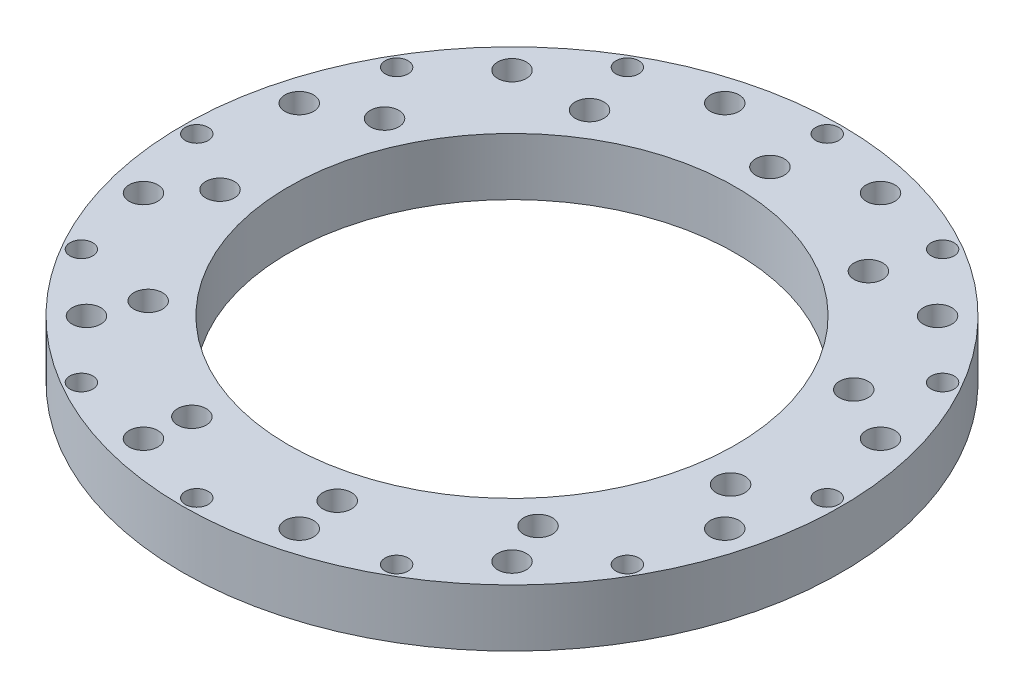
from build123d import *

# Parameters (mm, degrees)
SKETCH1_R           = 57.5
SKETCH1_R_2         = 39
SKETCH1_R_3         = 2
SKETCH1_R_4         = 2.5
BOSS_EXTRUDE1_DEPTH = 10
SKETCH2_R           = 2.5
CUT_EXTRUDE1_DEPTH  = 10


with BuildPart() as part:
    # Sketch1 → Boss-Extrude1 (new body)
    with BuildSketch(Plane(origin=(0, 0, 0), x_dir=(1, 0, 0), z_dir=(0, 1, 0))):
        Circle(SKETCH1_R)
        Circle(SKETCH1_R_2, mode=Mode.SUBTRACT)
        with Locations((0, 55)):
            Circle(SKETCH1_R_3, mode=Mode.SUBTRACT)
        with Locations((27.5, 47.631397208)):
            Circle(SKETCH1_R_3, mode=Mode.SUBTRACT)
        with Locations((47.631397208, 27.5)):
            Circle(SKETCH1_R_3, mode=Mode.SUBTRACT)
        with Locations((55, 0)):
            Circle(SKETCH1_R_3, mode=Mode.SUBTRACT)
        with Locations((47.631397208, -27.5)):
            Circle(SKETCH1_R_3, mode=Mode.SUBTRACT)
        with Locations((27.5, -47.631397208)):
            Circle(SKETCH1_R_3, mode=Mode.SUBTRACT)
        with Locations((0, -55)):
            Circle(SKETCH1_R_3, mode=Mode.SUBTRACT)
        with Locations((-27.5, -47.631397208)):
            Circle(SKETCH1_R_3, mode=Mode.SUBTRACT)
        with Locations((-47.631397208, -27.5)):
            Circle(SKETCH1_R_3, mode=Mode.SUBTRACT)
        with Locations((-55, 0)):
            Circle(SKETCH1_R_3, mode=Mode.SUBTRACT)
        with Locations((-47.631397208, 27.5)):
            Circle(SKETCH1_R_3, mode=Mode.SUBTRACT)
        with Locations((-27.5, 47.631397208)):
            Circle(SKETCH1_R_3, mode=Mode.SUBTRACT)
        with Locations((13.587999868, 50.71110588)):
            Circle(SKETCH1_R_4, mode=Mode.SUBTRACT)
        with Locations((37.123106012, 37.123106012)):
            Circle(SKETCH1_R_4, mode=Mode.SUBTRACT)
        with Locations((50.71110588, 13.587999868)):
            Circle(SKETCH1_R_4, mode=Mode.SUBTRACT)
        with Locations((50.71110588, -13.587999868)):
            Circle(SKETCH1_R_4, mode=Mode.SUBTRACT)
        with Locations((37.123106012, -37.123106012)):
            Circle(SKETCH1_R_4, mode=Mode.SUBTRACT)
        with Locations((13.587999868, -50.71110588)):
            Circle(SKETCH1_R_4, mode=Mode.SUBTRACT)
        with Locations((-13.587999868, -50.71110588)):
            Circle(SKETCH1_R_4, mode=Mode.SUBTRACT)
        with Locations((-37.123106012, -37.123106012)):
            Circle(SKETCH1_R_4, mode=Mode.SUBTRACT)
        with Locations((-50.71110588, -13.587999868)):
            Circle(SKETCH1_R_4, mode=Mode.SUBTRACT)
        with Locations((-50.71110588, 13.587999868)):
            Circle(SKETCH1_R_4, mode=Mode.SUBTRACT)
        with Locations((-37.123106012, 37.123106012)):
            Circle(SKETCH1_R_4, mode=Mode.SUBTRACT)
        with Locations((-13.587999868, 50.71110588)):
            Circle(SKETCH1_R_4, mode=Mode.SUBTRACT)
    extrude(amount=BOSS_EXTRUDE1_DEPTH)

    # Sketch2 → Cut-Extrude1 (cut)
    with BuildSketch(Plane(origin=(0, 10, 0), x_dir=(1, 0, 0), z_dir=(0, 1, 0))):
        with Locations((0, 45)):
            Circle(SKETCH2_R)
        with Locations((24.328836786, 37.856408977)):
            Circle(SKETCH2_R)
        with Locations((40.933439791, 18.693675585)):
            Circle(SKETCH2_R)
        with Locations((44.541964885, -6.404167722)):
            Circle(SKETCH2_R)
        with Locations((34.008730846, -29.468733028)):
            Circle(SKETCH2_R)
        with Locations((12.677965058, -43.177183813)):
            Circle(SKETCH2_R)
        with Locations((-12.677965058, -43.177183813)):
            Circle(SKETCH2_R)
        with Locations((-34.008730846, -29.468733028)):
            Circle(SKETCH2_R)
        with Locations((-44.541964885, -6.404167722)):
            Circle(SKETCH2_R)
        with Locations((-40.933439791, 18.693675585)):
            Circle(SKETCH2_R)
        with Locations((-24.328836786, 37.856408977)):
            Circle(SKETCH2_R)
    extrude(amount=-CUT_EXTRUDE1_DEPTH, mode=Mode.SUBTRACT)


solid = part.part
